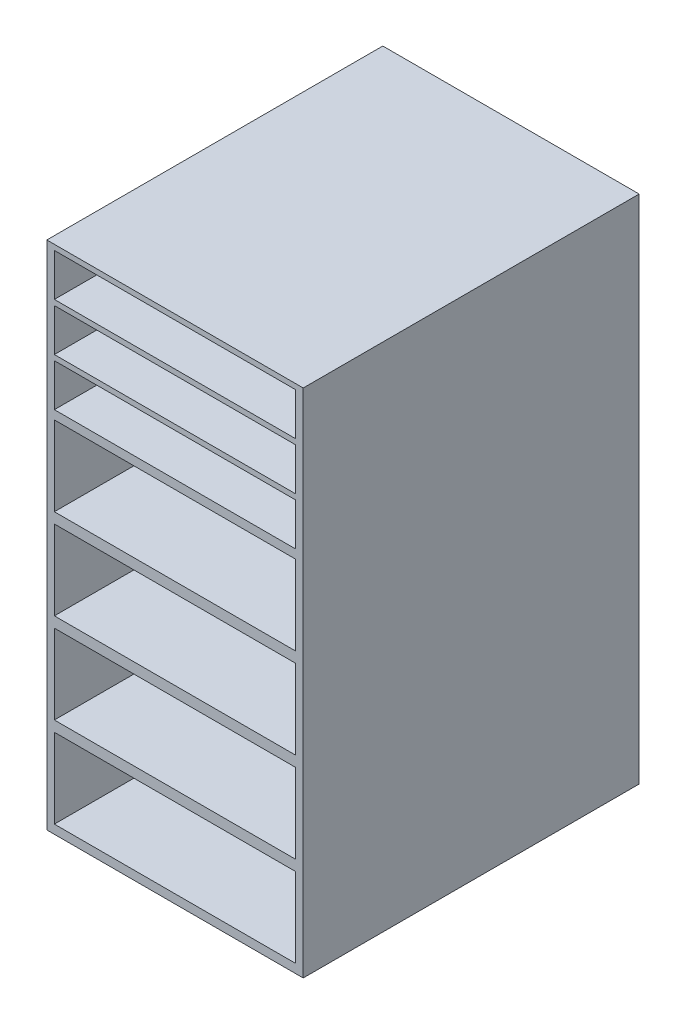
from build123d import *

# Parameters (mm, degrees)
SKETCH1_W           = 72.5
SKETCH1_H           = 95
BOSS_EXTRUDE1_DEPTH = 104.5
SKETCH2_W           = 68.25
SKETCH2_H           = 22.5
CUT_EXTRUDE1_DEPTH  = 90
SKETCH3_W           = 72.5
SKETCH3_H           = 95
BOSS_EXTRUDE2_DEPTH = 175.5
SKETCH4_W           = 68.25
SKETCH4_H           = 12
CUT_EXTRUDE3_DEPTH  = 90


with BuildPart() as part:
    # Sketch1 → Boss-Extrude1 (new body)
    with BuildSketch(Plane(origin=(0, 0, 0), x_dir=(1, 0, 0), z_dir=(0, 1, 0))):
        Rectangle(SKETCH1_W, SKETCH1_H)
    extrude(amount=BOSS_EXTRUDE1_DEPTH)

    # Sketch2 → Cut-Extrude1 (cut)
    with BuildSketch(Plane.XY.offset(47.5)):
        with Locations((0, 13.75)):
            Rectangle(SKETCH2_W, SKETCH2_H)
        with Locations((0, 39.25)):
            Rectangle(SKETCH2_W, SKETCH2_H)
        with Locations((0, 64.75)):
            Rectangle(SKETCH2_W, SKETCH2_H)
        with Locations((0, 90.25)):
            Rectangle(SKETCH2_W, SKETCH2_H)
    extrude(amount=-CUT_EXTRUDE1_DEPTH, mode=Mode.SUBTRACT)

    # Sketch3 → Boss-Extrude2 (add)
    with BuildSketch(Plane(origin=(0, 104.5, 0), x_dir=(1, 0, 0), z_dir=(0, 1, 0))):
        Rectangle(SKETCH3_W, SKETCH3_H)
    extrude(amount=BOSS_EXTRUDE2_DEPTH)

    # Sketch4 → Cut-Extrude3 (cut)
    with BuildSketch(Plane.XY.offset(47.5)):
        with Locations((0, 110)):
            Rectangle(SKETCH4_W, SKETCH4_H)
        with Locations((0, 123.5)):
            Rectangle(SKETCH4_W, SKETCH4_H)
        with Locations((0, 137)):
            Rectangle(SKETCH4_W, SKETCH4_H)
        with Locations((0, 150.5)):
            Rectangle(SKETCH4_W, SKETCH4_H)
        with Locations((0, 164)):
            Rectangle(SKETCH4_W, SKETCH4_H)
        with Locations((0, 177.5)):
            Rectangle(SKETCH4_W, SKETCH4_H)
        with Locations((0, 191)):
            Rectangle(SKETCH4_W, SKETCH4_H)
        with Locations((0, 204.5)):
            Rectangle(SKETCH4_W, SKETCH4_H)
        with Locations((0, 218)):
            Rectangle(SKETCH4_W, SKETCH4_H)
        with Locations((0, 231.5)):
            Rectangle(SKETCH4_W, SKETCH4_H)
        with Locations((0, 245)):
            Rectangle(SKETCH4_W, SKETCH4_H)
        with Locations((0, 258.5)):
            Rectangle(SKETCH4_W, SKETCH4_H)
        with Locations((0, 272)):
            Rectangle(SKETCH4_W, SKETCH4_H)
    extrude(amount=-CUT_EXTRUDE3_DEPTH, mode=Mode.SUBTRACT)

    # Split1
    split(bisect_by=Plane(origin=(-34.125, 144.5, -42.5), x_dir=(0, 0, -1), z_dir=(0, -1, 0)), keep=Keep.TOP)


solid = part.part
